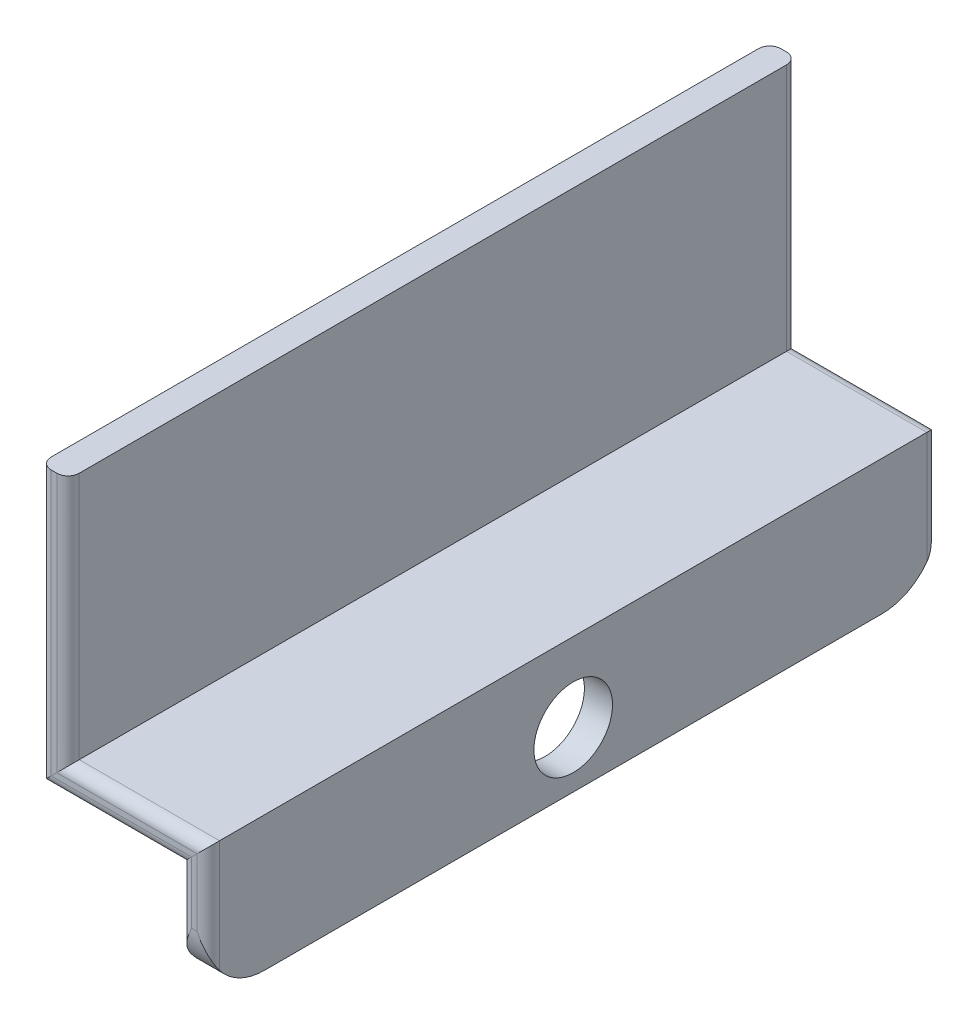
from build123d import *

# Parameters (mm, degrees)
CUT_EXTRUDE1_DEPTH      = 99.145249503
CUT_EXTRUDE1_DEPTH_BACK = 99.145249503
SKETCH3_R               = 7
FILLET2_R               = 10
FILLET3_R               = 10


with BuildPart() as part:
    # Sweep1: sweep along a curve in space
    with BuildLine() as sweep1_path:
        Line((0, 0, 0), (0, 21.5, 0))
        Line((0, 21.5, 0), (-25, 21.5, 0))
        Line((-25, 21.5, 0), (-25, 68.2, 0))
    # Sketch2 → Sweep1 (sweep)
    with BuildSketch(Plane(origin=(0, 0, 0), x_dir=(1, 0, 0), z_dir=(0, 1, 0))):
        with BuildLine():
            Line((-0.5, 65), (0.5, 65))
            ThreePointArc((0.5, 65), (1.914213562, 64.414213562), (2.5, 63))
            Line((2.5, 63), (2.5, -63))
            ThreePointArc((2.5, -63), (1.914213562, -64.414213562), (0.5, -65))
            Line((0.5, -65), (-0.5, -65))
            ThreePointArc((-0.5, -65), (-1.914213562, -64.414213562), (-2.5, -63))
            Line((-2.5, -63), (-2.5, 63))
            ThreePointArc((-2.5, 63), (-1.914213562, 64.414213562), (-0.5, 65))
        make_face()
    sweep(path=sweep1_path.line, transition=Transition.RIGHT)

    # Sketch3 → Cut-Extrude1 (cut, two sides: drawn at the far end of the back side and taken through both)
    with BuildSketch(Plane(origin=(0, 0, 0), x_dir=(0, 0, -1), z_dir=(1, 0, 0)).offset(-CUT_EXTRUDE1_DEPTH_BACK)):
        with Locations((0, 10)):
            Circle(SKETCH3_R)
    extrude(amount=CUT_EXTRUDE1_DEPTH + CUT_EXTRUDE1_DEPTH_BACK, mode=Mode.SUBTRACT)

    # Fillet2
    # the kernel refuses this fillet: 10 mm, written as the material it takes off along each edge
    with BuildSketch(Plane(origin=(25.5, 0, -65), x_dir=(0, 1, 0), z_dir=(-1, 0, 0))) as fillet2_piece_1:
        with BuildLine():
            CenterArc((FILLET2_R, -FILLET2_R), FILLET2_R, 90, 90)
            Line((0, -FILLET2_R), (0, 0))
            Line((0, 0), (FILLET2_R, 0))
        make_face()
    extrude(amount=51, mode=Mode.SUBTRACT)

    # Fillet3
    # the kernel refuses this fillet: 10 mm, written as the material it takes off along each edge
    with BuildSketch(Plane(origin=(-25.5, 0, 65), x_dir=(0, 1, 0), z_dir=(1, 0, 0))) as fillet3_piece_1:
        with BuildLine():
            CenterArc((FILLET3_R, -FILLET3_R), FILLET3_R, 90, 90)
            Line((0, -FILLET3_R), (0, 0))
            Line((0, 0), (FILLET3_R, 0))
        make_face()
    extrude(amount=51, mode=Mode.SUBTRACT)


solid = part.part
